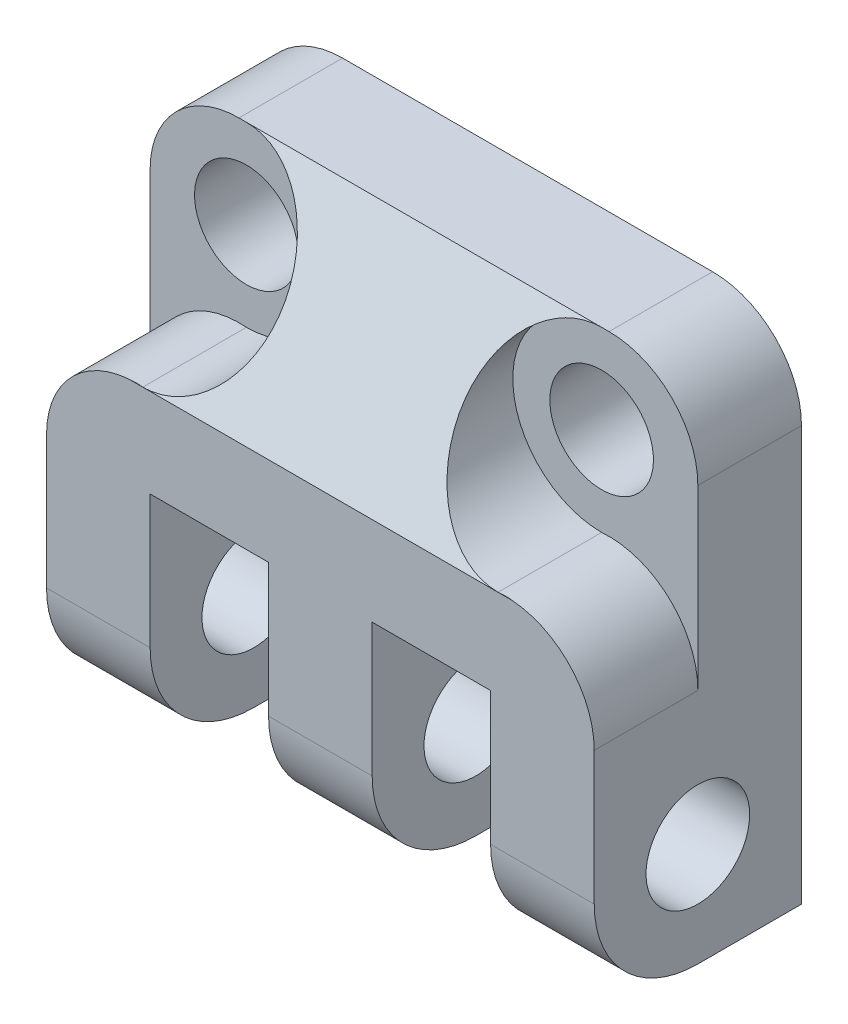
from build123d import *

# Parameters (mm, degrees)
SKETCH1_W             = 18.5
SKETCH1_H             = 9
BOSS_EXTRUDE1_DEPTH   = 3.5
SKETCH2_R             = 1.75
CUT_EXTRUDE1_DEPTH    = 11.865656906
BOSS_EXTRUDE3_DEPTH   = 7
CUT_EXTRUDE3_DEPTH    = 24.398717914
SKETCH8_R             = 1.75
CUT_EXTRUDE4_DEPTH    = 24.398717914
FILLET1_R             = 3
CUT_EXTRUDE5_DEPTH    = 24.398717914
BODY_MOVE_COPY1_ANGLE = 90


with BuildPart() as part:
    # Sketch1 → Boss-Extrude1 (new body)
    with BuildSketch(Plane(origin=(0, 0, 0), x_dir=(1, 0, 0), z_dir=(0, 1, 0))):
        Rectangle(SKETCH1_W, SKETCH1_H)
    extrude(amount=BOSS_EXTRUDE1_DEPTH)

    # Sketch2 → Cut-Extrude1 (cut, through all)
    with BuildSketch(Plane(origin=(0, 3.5, 0), x_dir=(1, 0, 0), z_dir=(0, 1, 0))):
        with Locations((-6, 1.5)):
            Circle(SKETCH2_R)
        with Locations((6, 1.5)):
            Circle(SKETCH2_R)
    extrude(amount=-CUT_EXTRUDE1_DEPTH, mode=Mode.SUBTRACT)

    # Sketch4 → Boss-Extrude3 (add)
    with BuildSketch(Plane.XZ):
        with BuildLine():
            Line((-1.75, 12.5), (1.75, 12.5))
            Line((1.75, 12.5), (1.75, 4.5))
            Line((1.75, 4.5), (5.75, 4.5))
            Line((5.75, 4.5), (5.75, 12.5))
            Line((5.75, 12.5), (9.25, 12.5))
            Line((9.25, 12.5), (9.25, 4.5))
            ThreePointArc((9.25, 4.5), (8.281746848, 2.288524248), (6, 1.5))
            ThreePointArc((6, 1.5), (3.878679656, 0.621320344), (3, -1.5))
            ThreePointArc((3, -1.5), (3.878679656, -3.621320344), (6, -4.5))
            Line((6, -4.5), (-6, -4.5))
            ThreePointArc((-6, -4.5), (-3.878679656, -3.621320344), (-3, -1.5))
            ThreePointArc((-3, -1.5), (-3.878679656, 0.621320344), (-6, 1.5))
            ThreePointArc((-6, 1.5), (-8.281746848, 2.288524248), (-9.25, 4.5))
            Line((-9.25, 4.5), (-9.25, 12.5))
            Line((-9.25, 12.5), (-5.75, 12.5))
            Line((-5.75, 12.5), (-5.75, 4.5))
            Line((-5.75, 4.5), (-1.75, 4.5))
            Line((-1.75, 4.5), (-1.75, 12.5))
        make_face()
    extrude(amount=-BOSS_EXTRUDE3_DEPTH)

    # Sketch7 → Cut-Extrude3 (cut, through all)
    with BuildSketch(Plane(origin=(9.25, 0, 0), x_dir=(0, 0, -1), z_dir=(1, 0, 0))):
        with BuildLine():
            ThreePointArc((-12.5, 3.5), (-11.474873734, 5.974873734), (-9, 7))
            Line((-9, 7), (-12.5, 7))
            Line((-12.5, 7), (-12.5, 3.5))
        make_face()
    extrude(amount=-CUT_EXTRUDE3_DEPTH, mode=Mode.SUBTRACT)

    # Sketch8 → Cut-Extrude4 (cut, through all)
    with BuildSketch(Plane(origin=(9.25, 0, 0), x_dir=(0, 0, -1), z_dir=(1, 0, 0))):
        with Locations((-9, 3.5)):
            Circle(SKETCH8_R)
    extrude(amount=-CUT_EXTRUDE4_DEPTH, mode=Mode.SUBTRACT)

    # Fillet1
    fillet1_edges = [part.edges().sort_by_distance(p)[0] for p in [
        (-9.25, 1.75, -4.5),
        (9.25, 1.75, -4.5),
    ]]
    fillet(fillet1_edges, radius=FILLET1_R)

    # Sketch6 → Cut-Extrude5 (cut, through all)
    with BuildSketch(Plane(origin=(9.25, 0, 0), x_dir=(0, 0, -1), z_dir=(1, 0, 0))):
        Polygon((-1.5, 7), (4.5, 3.5), (4.5, 7), align=None)
    extrude(amount=-CUT_EXTRUDE5_DEPTH, mode=Mode.SUBTRACT)


with BuildPart() as part_1:
    # Body-Move/Copy1: moved
    add(part.part.rotate(Axis((0, 3.5, 4), (1, 0, 0)), BODY_MOVE_COPY1_ANGLE))


solid = part_1.part
